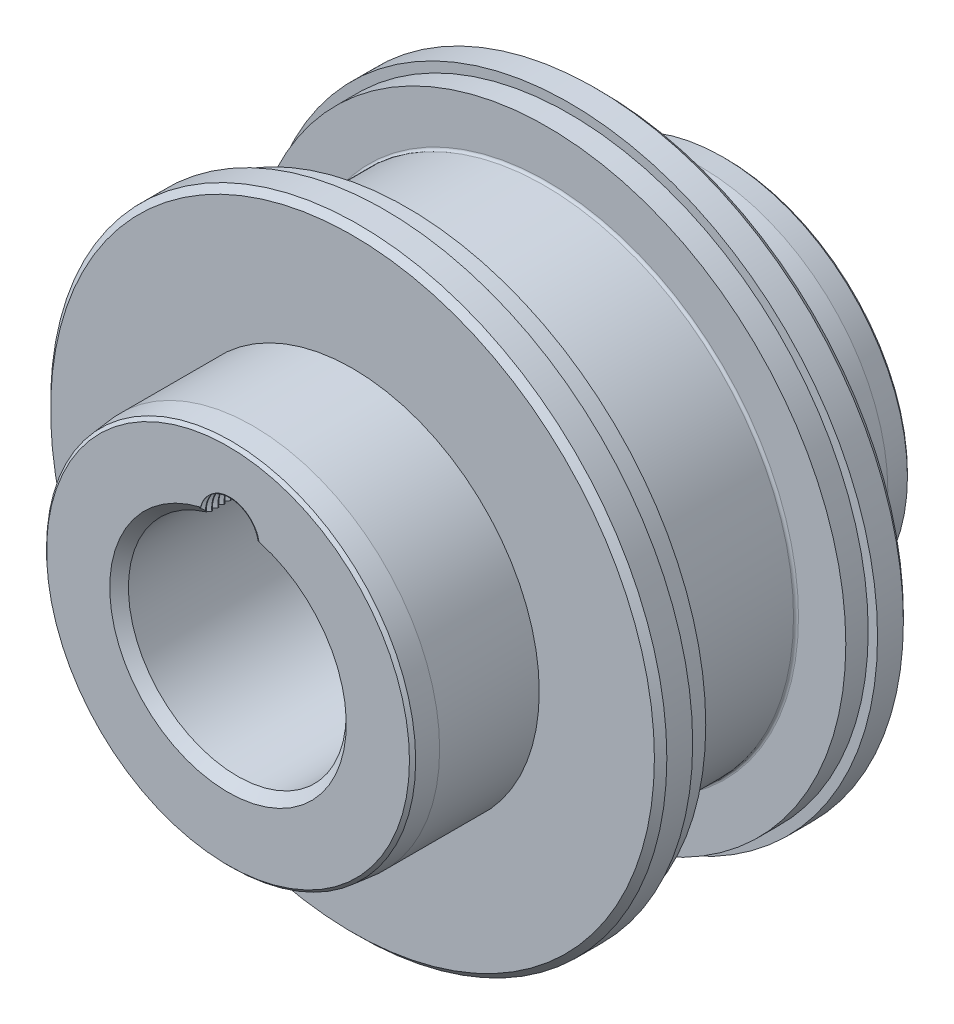
from build123d import *

# Parameters (mm, degrees)
THREAD1_PITCH = 1


with BuildPart() as part:
    # Sketch2 → Revolve1 (revolve)
    with BuildSketch(Plane(origin=(0, 0, 0), x_dir=(0, 0, -1), z_dir=(1, 0, 0)), mode=Mode.PRIVATE) as revolve1_sk:
        with BuildLine():
            Line((-38.5, 17.5), (5, 17.5))
            ThreePointArc((5, 17.5), (5.292893219, 18.207106781), (6, 18.5))
            Line((6, 18.5), (36, 18.5))
            Line((36, 18.5), (40, 19.5))
            Line((40, 19.5), (40, 29.15))
            Line((40, 29.15), (39.5, 29.65))
            Line((39.5, 29.65), (36, 30))
            Line((36, 30), (20, 30))
            Line((20, 30), (20, 48.5))
            Line((20, 48.5), (19, 49.5))
            Line((19, 49.5), (14.85, 49.5))
            Line((14.85, 49.5), (14.85, 48))
            Line((14.85, 48), (11.25, 48))
            Line((11.25, 48), (11.25, 40.4))
            ThreePointArc((11.25, 40.4), (11.132842712, 40.117157288), (10.85, 40))
            Line((10.85, 40), (-10.85, 40))
            ThreePointArc((-10.85, 40), (-11.132842712, 40.117157288), (-11.25, 40.4))
            Line((-11.25, 40.4), (-11.25, 48))
            Line((-11.25, 48), (-14.85, 48))
            Line((-14.85, 48), (-14.85, 49.5))
            Line((-14.85, 49.5), (-19, 49.5))
            Line((-19, 49.5), (-20, 48.5))
            Line((-20, 48.5), (-20, 30))
            Line((-20, 30), (-36, 30))
            Line((-36, 30), (-39.5, 29.65))
            Line((-39.5, 29.65), (-40, 29.15))
            Line((-40, 29.15), (-40, 19))
            Line((-40, 19), (-38.5, 17.5))
        make_face()
    revolve(revolve1_sk.sketch.rotate(Axis((0, 0, 40), (0, 0, -1)), 90), axis=Axis((0, 0, 40), (0, 0, -1)))

    # Sketch4 → M10 Clearance Hole1 (revolve, cut)
    with BuildSketch(Plane(origin=(0, 17.5, 40), x_dir=(0, -1, 0), z_dir=(1, 0, 0))):
        Polygon((0, 0), (0, 20.703872786), (4.5, 18), (4.5, 0), align=None)
    revolve(axis=Axis((0, 17.5, 46.35), (0, 0, -1)), mode=Mode.SUBTRACT)

    # Thread1: arcs per turn and ends read off the stored shape
    # Thread1: the profile of Thread Profile1 profile screwed along a right-hand helix through 18 turns, 8 arcs to a turn; built about Z, then put on its axis
    thread1_z = Axis((0, 0, 0), (0, 0, 1))
    thread1_corners = [(4.4997, 0, -0.000173205), (4.4997, 0, 0.875173202), (5.041265875, 0, 0.562499999), (5.041265875, 0, 0.312499999)]
    with BuildLine(mode=Mode.PRIVATE) as thread1_profile:
        Line(thread1_corners[0], thread1_corners[1])
        Line(thread1_corners[1], thread1_corners[2])
        Line(thread1_corners[2], thread1_corners[3])
        Line(thread1_corners[3], thread1_corners[0])
    thread1_cap = Face(thread1_profile.wire())
    thread1_turn_angles = [0, 22.5, 45, 67.5, 90, 112.5, 135, 157.5, 180, 202.5, 225, 247.5, 270, 292.5, 315, 337.5, 360]
    thread1_turn_weights = [1, 0.9238795325112867, 1, 0.9238795325112867, 1, 0.9238795325112867, 1, 0.9238795325112867, 1, 0.9238795325112867, 1, 0.9238795325112867, 1, 0.9238795325112867, 1, 0.9238795325112867, 1]
    thread1_turn_rails = [Edge.make_bspline([Vector(p[0], p[1], 0).rotate(thread1_z, thread1_turn_angles[k]) / thread1_turn_weights[k] + Vector(0, 0, p[2] + THREAD1_PITCH * thread1_turn_angles[k] / 360) for k in range(17)], [0, 0, 0, 1, 1, 2, 2, 3, 3, 4, 4, 5, 5, 6, 6, 7, 7, 8, 8, 8], 2, thread1_turn_weights) for p in thread1_corners]
    thread1_turn_sides = [Face.make_surface_from_curves(thread1_turn_rails[p[0]], thread1_turn_rails[p[1]]) for p in [(0, 1), (1, 2), (2, 3), (3, 0)]]
    thread1 = Plane(origin=(0, 17.5, 41), x_dir=(-1, 0, 0), z_dir=(0, 0, -1)) * Solid(Shell([*[p.moved(Location((0, 0, THREAD1_PITCH * i))) for i in range(18) for p in thread1_turn_sides], thread1_cap, thread1_cap.rotate(thread1_z, 6480).moved(Location((0, 0, THREAD1_PITCH * 6480 / 360)))]))
    add(thread1, mode=Mode.SUBTRACT)


solid = part.part
